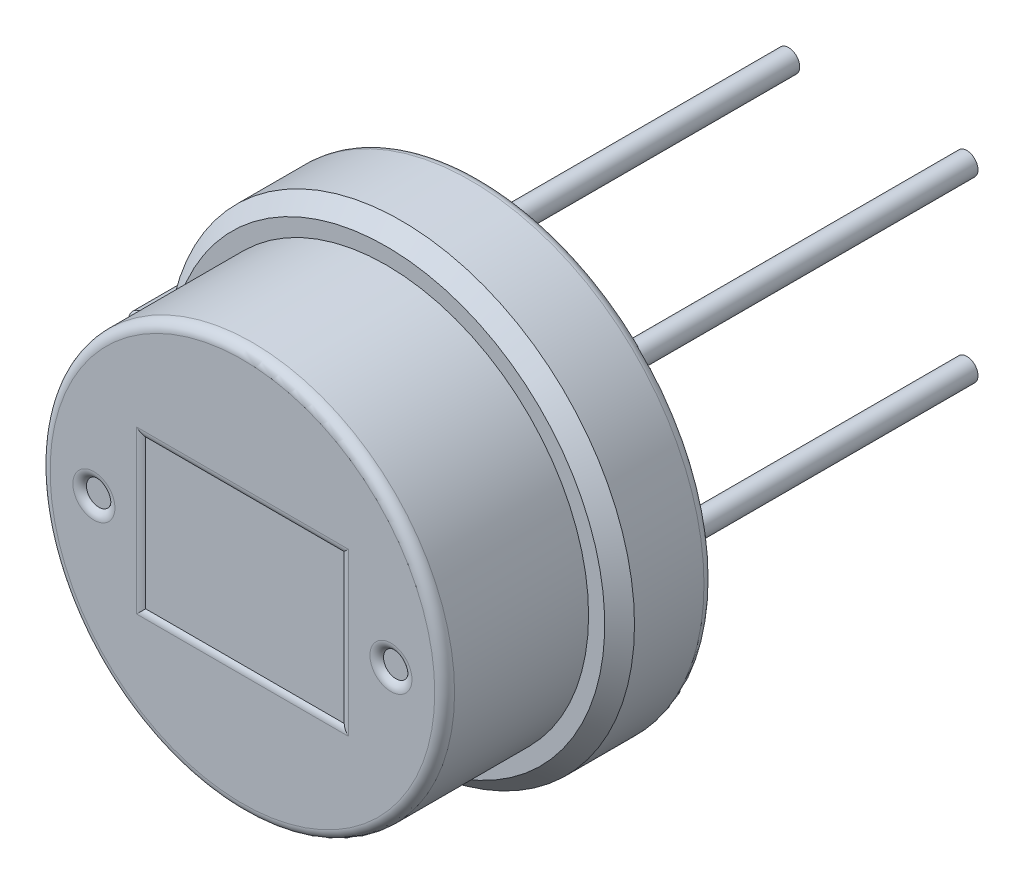
from build123d import *

# Parameters (mm, degrees)
EXTRUDE_417_DEPTH      = 1.9
SKETCH_3_R             = 4.075
EXTRUDE_605_DEPTH      = 2.9
SKETCH_6_W             = 4
SKETCH_6_H             = 3
CUT_EXTRUDE_752_DEPTH  = 0.05
SKETCH_7_R             = 0.25
CUT_EXTRUDE_1002_DEPTH = 0.1
SKETCH_4_R             = 0.225
EXTRUDE_1397_DEPTH     = 8
CHAMFER_1_SIZE         = 0.3
FILLET_1_R             = 0.2


# Some blends are built 0.0001 mm under size
with BuildPart() as part:
    # 草图2 → Extrude 417 (new body)
    with BuildSketch(Plane.XY):
        with BuildLine():
            Line((-5.5, 0.2), (-5.5, -0.2))
            ThreePointArc((-5.5, -0.2), (-5.412132034, -0.412132034), (-5.2, -0.5))
            Line((-5.2, -0.5), (-4.935585072, -0.5))
            ThreePointArc((-4.935585072, -0.5), (-4.741162851, -0.571526807), (-4.639449967, -0.752))
            ThreePointArc((-4.639449967, -0.752), (4.7, 0), (-4.639449967, 0.752))
            ThreePointArc((-4.639449967, 0.752), (-4.741162851, 0.571526807), (-4.935585072, 0.5))
            Line((-4.935585072, 0.5), (-5.2, 0.5))
            ThreePointArc((-5.2, 0.5), (-5.412132034, 0.412132034), (-5.5, 0.2))
        make_face()
    extrude(amount=EXTRUDE_417_DEPTH)

    # 草图3 → Extrude 605 (add)
    with BuildSketch(Plane.XY.offset(1.9)):
        Circle(SKETCH_3_R)
    extrude(amount=EXTRUDE_605_DEPTH)

    # 草图6 → Cut-Extrude 752 (cut)
    with BuildSketch(Plane.XY.offset(4.8)):
        Rectangle(SKETCH_6_W, SKETCH_6_H)
    extrude(amount=-CUT_EXTRUDE_752_DEPTH, mode=Mode.SUBTRACT)

    # 草图7 → Cut-Extrude 1002 (cut)
    with BuildSketch(Plane.XY.offset(4.8)):
        with Locations((-2.992635388, 0)):
            Circle(SKETCH_7_R)
        with Locations(Location((2.992635388, 0, 0), (0, 0, 180))):
            Circle(SKETCH_7_R)
    extrude(amount=-CUT_EXTRUDE_1002_DEPTH, mode=Mode.SUBTRACT)

    # 草图4 → Extrude 1397 (add)
    with BuildSketch(Plane(origin=(0, 0, 0), x_dir=(-1, 0, 0), z_dir=(0, 0, -1))):
        with Locations(Location((-1.796051224, -1.796051224, 0), (0, 0, 180))):
            Circle(SKETCH_4_R)
        with Locations(Location((-1.796051224, 1.796051224, 0), (0, 0, 180))):
            Circle(SKETCH_4_R)
        with Locations(Location((1.796051224, -1.796051224, 0), (0, 0, 180))):
            Circle(SKETCH_4_R)
        with Locations(Location((1.796051224, 1.796051224, 0), (0, 0, 180))):
            Circle(SKETCH_4_R)
    extrude(amount=EXTRUDE_1397_DEPTH)

    # 倒角1
    chamfer_1_edges = [part.edges().sort_by_distance(p)[0] for p in [
        (-4.741162851, 0.571526807, 1.9),
        (-5.067792536, 0.5, 1.9),
        (-5.412132034, 0.412132034, 1.9),
        (-5.5, 0, 1.9),
        (-5.412132034, -0.412132034, 1.9),
        (-5.067792536, -0.5, 1.9),
        (-4.741162851, -0.571526807, 1.9),
        (4.7, 0, 1.9),
    ]]
    chamfer(chamfer_1_edges, length=CHAMFER_1_SIZE - 0.0001)  # a hair under: the kernel refuses the full size

    # 圆角1
    # the kernel refuses this fillet: 0.2 mm, written as the material it takes off along each edge
    with BuildSketch(Plane(origin=(-4.935585072, -0.8, 0), x_dir=(0, 1, 0), z_dir=(-1, 0, 0))) as fillet_1_piece_1:
        with BuildLine():
            CenterArc((0.3 + FILLET_1_R, -FILLET_1_R), FILLET_1_R, 90, 90)
            Line((0.3, -FILLET_1_R), (0.3 - FILLET_1_R * 0.02, -FILLET_1_R))
            Line((0.3 - FILLET_1_R * 0.02, -FILLET_1_R), (0.3 - FILLET_1_R * 0.02, FILLET_1_R * 0.02))
            Line((0.3 - FILLET_1_R * 0.02, FILLET_1_R * 0.02), (0.3 + FILLET_1_R, FILLET_1_R * 0.02))
            Line((0.3 + FILLET_1_R, FILLET_1_R * 0.02), (0.3 + FILLET_1_R, 0))
        make_face()
    revolve(axis=Axis((-4.935585072, -0.8, 0), (0, 0, -1)), revolution_arc=80.793103779, mode=Mode.SUBTRACT)
    with BuildSketch(Plane(origin=(-5.2, -0.5, 0), x_dir=(0, 1, 0), z_dir=(1, 0, 0))) as fillet_1_piece_2:
        with BuildLine():
            CenterArc((FILLET_1_R, FILLET_1_R), FILLET_1_R, 180, 90)
            Line((0, FILLET_1_R), (-FILLET_1_R * 0.02, FILLET_1_R))
            Line((-FILLET_1_R * 0.02, FILLET_1_R), (-FILLET_1_R * 0.02, -FILLET_1_R * 0.02))
            Line((-FILLET_1_R * 0.02, -FILLET_1_R * 0.02), (FILLET_1_R, -FILLET_1_R * 0.02))
            Line((FILLET_1_R, -FILLET_1_R * 0.02), (FILLET_1_R, 0))
        make_face()
    extrude(amount=0.264414928, mode=Mode.SUBTRACT)
    with BuildSketch(Plane(origin=(-5.2, -0.2, 0), x_dir=(-1, 0, 0), z_dir=(0, 1, 0))) as fillet_1_piece_3:
        with BuildLine():
            CenterArc((0.3 - FILLET_1_R, FILLET_1_R), FILLET_1_R, 270, 90)
            Line((0.3, FILLET_1_R), (0.3 + FILLET_1_R * 0.02, FILLET_1_R))
            Line((0.3 + FILLET_1_R * 0.02, FILLET_1_R), (0.3 + FILLET_1_R * 0.02, -FILLET_1_R * 0.02))
            Line((0.3 + FILLET_1_R * 0.02, -FILLET_1_R * 0.02), (0.3 - FILLET_1_R, -FILLET_1_R * 0.02))
            Line((0.3 - FILLET_1_R, -FILLET_1_R * 0.02), (0.3 - FILLET_1_R, 0))
        make_face()
    revolve(axis=Axis((-5.2, -0.2, 0), (0, 0, 1)), revolution_arc=90, mode=Mode.SUBTRACT)
    with BuildSketch(Plane(origin=(-5.5, 0.2, 0), x_dir=(1, 0, 0), z_dir=(0, -1, 0))) as fillet_1_piece_4:
        with BuildLine():
            CenterArc((FILLET_1_R, FILLET_1_R), FILLET_1_R, 180, 90)
            Line((0, FILLET_1_R), (-FILLET_1_R * 0.02, FILLET_1_R))
            Line((-FILLET_1_R * 0.02, FILLET_1_R), (-FILLET_1_R * 0.02, -FILLET_1_R * 0.02))
            Line((-FILLET_1_R * 0.02, -FILLET_1_R * 0.02), (FILLET_1_R, -FILLET_1_R * 0.02))
            Line((FILLET_1_R, -FILLET_1_R * 0.02), (FILLET_1_R, 0))
        make_face()
    extrude(amount=0.4, mode=Mode.SUBTRACT)
    with BuildSketch(Plane(origin=(-5.2, 0.2, 0), x_dir=(0, 1, 0), z_dir=(1, 0, 0))) as fillet_1_piece_5:
        with BuildLine():
            CenterArc((0.3 - FILLET_1_R, FILLET_1_R), FILLET_1_R, 270, 90)
            Line((0.3 - FILLET_1_R, 0), (0.3 - FILLET_1_R, -FILLET_1_R * 0.02))
            Line((0.3 - FILLET_1_R, -FILLET_1_R * 0.02), (0.3 + FILLET_1_R * 0.02, -FILLET_1_R * 0.02))
            Line((0.3 + FILLET_1_R * 0.02, -FILLET_1_R * 0.02), (0.3 + FILLET_1_R * 0.02, FILLET_1_R))
            Line((0.3 + FILLET_1_R * 0.02, FILLET_1_R), (0.3, FILLET_1_R))
        make_face()
    revolve(axis=Axis((-5.2, 0.2, 0), (0, 0, 1)), revolution_arc=90, mode=Mode.SUBTRACT)
    with BuildSketch(Plane(origin=(-4.935585072, 0.5, 0), x_dir=(0, 0, 1), z_dir=(-1, 0, 0))) as fillet_1_piece_6:
        with BuildLine():
            CenterArc((FILLET_1_R, -FILLET_1_R), FILLET_1_R, 90, 90)
            Line((0, -FILLET_1_R), (-FILLET_1_R * 0.02, -FILLET_1_R))
            Line((-FILLET_1_R * 0.02, -FILLET_1_R), (-FILLET_1_R * 0.02, FILLET_1_R * 0.02))
            Line((-FILLET_1_R * 0.02, FILLET_1_R * 0.02), (FILLET_1_R, FILLET_1_R * 0.02))
            Line((FILLET_1_R, FILLET_1_R * 0.02), (FILLET_1_R, 0))
        make_face()
    extrude(amount=0.264414928, mode=Mode.SUBTRACT)
    with BuildSketch(Plane(origin=(-4.935585072, 0.8, 0), x_dir=(0.9871170143402451, -0.16000000000000056, 0), z_dir=(0.16000000000000056, 0.9871170143402451, 0))) as fillet_1_piece_7:
        with BuildLine():
            CenterArc((0.3 + FILLET_1_R, -FILLET_1_R), FILLET_1_R, 90, 90)
            Line((0.3, -FILLET_1_R), (0.3 - FILLET_1_R * 0.02, -FILLET_1_R))
            Line((0.3 - FILLET_1_R * 0.02, -FILLET_1_R), (0.3 - FILLET_1_R * 0.02, FILLET_1_R * 0.02))
            Line((0.3 - FILLET_1_R * 0.02, FILLET_1_R * 0.02), (0.3 + FILLET_1_R, FILLET_1_R * 0.02))
            Line((0.3 + FILLET_1_R, FILLET_1_R * 0.02), (0.3 + FILLET_1_R, 0))
        make_face()
    revolve(axis=Axis((-4.935585072, 0.8, 0), (0, 0, -1)), revolution_arc=80.793103779, mode=Mode.SUBTRACT)
    with BuildSketch(Plane(origin=(0, 0, 4.8), x_dir=(1, 0, 0), z_dir=(0, -1, 0))) as fillet_1_piece_8:
        with BuildLine():
            CenterArc((4.075 - FILLET_1_R, -FILLET_1_R), FILLET_1_R, 0, 90)
            Line((4.075 - FILLET_1_R, 0), (4.075 - FILLET_1_R, FILLET_1_R * 0.02))
            Line((4.075 - FILLET_1_R, FILLET_1_R * 0.02), (4.075 + FILLET_1_R * 0.02, FILLET_1_R * 0.02))
            Line((4.075 + FILLET_1_R * 0.02, FILLET_1_R * 0.02), (4.075 + FILLET_1_R * 0.02, -FILLET_1_R))
            Line((4.075 + FILLET_1_R * 0.02, -FILLET_1_R), (4.075, -FILLET_1_R))
        make_face()
    revolve(axis=Axis((0, 0, 4.8), (0, 0, 1)), mode=Mode.SUBTRACT)
    with BuildSketch(Plane(origin=(0, 0, 0), x_dir=(-0.9871170143402452, -0.16000000000000036, 0), z_dir=(-0.16000000000000036, 0.9871170143402452, 0))) as fillet_1_piece_9:
        with BuildLine():
            CenterArc((4.7 - FILLET_1_R, FILLET_1_R), FILLET_1_R, 270, 90)
            Line((4.7, FILLET_1_R), (4.7 + FILLET_1_R * 0.02, FILLET_1_R))
            Line((4.7 + FILLET_1_R * 0.02, FILLET_1_R), (4.7 + FILLET_1_R * 0.02, -FILLET_1_R * 0.02))
            Line((4.7 + FILLET_1_R * 0.02, -FILLET_1_R * 0.02), (4.7 - FILLET_1_R, -FILLET_1_R * 0.02))
            Line((4.7 - FILLET_1_R, -FILLET_1_R * 0.02), (4.7 - FILLET_1_R, 0))
        make_face()
    revolve(axis=Axis((0, 0, 0), (0, 0, 1)), revolution_arc=341.586207557, mode=Mode.SUBTRACT)
    with BuildSketch(Plane(origin=(2.992635388, 0, 4.8), x_dir=(-1, 0, 0), z_dir=(0, 1, 0))) as fillet_1_piece_10:
        with BuildLine():
            CenterArc((0.423205081, -0.2), FILLET_1_R, 90, 60)
            Line((0.25, -0.1), (0.246535898, -0.098))
            ThreePointArc((0.246535898, -0.098), (0.246, -0.05), (0.246, 0))
            Line((0.246, 0), (0.25, 0.004))
            Line((0.25, 0.004), (0.423205081, 0.004))
            Line((0.423205081, 0.004), (0.423205081, 0))
        make_face()
    revolve(axis=Axis((2.992635388, 0, 4.8), (0, 0, 1)), mode=Mode.SUBTRACT)
    with BuildSketch(Plane(origin=(-2.992635388, 0, 4.8), x_dir=(1, 0, 0), z_dir=(0, -1, 0))) as fillet_1_piece_11:
        with BuildLine():
            CenterArc((0.423205081, -0.2), FILLET_1_R, 90, 60)
            Line((0.25, -0.1), (0.246535898, -0.098))
            ThreePointArc((0.246535898, -0.098), (0.246, -0.05), (0.246, 0))
            Line((0.246, 0), (0.25, 0.004))
            Line((0.25, 0.004), (0.423205081, 0.004))
            Line((0.423205081, 0.004), (0.423205081, 0))
        make_face()
    revolve(axis=Axis((-2.992635388, 0, 4.8), (0, 0, 1)), mode=Mode.SUBTRACT)
    with BuildSketch(Plane(origin=(-2, 1.5, 4.8), x_dir=(0, 1, 0), z_dir=(1, 0, 0)), Plane(origin=(2, -1.5, 4.8), x_dir=(0, -1, 0), z_dir=(-1, 0, 0))) as fillet_1_piece_12:
        with BuildLine():
            CenterArc((0.132287566, -0.2), FILLET_1_R, 90, 41.409622109)
            Line((0, -0.05), (-0.002645751, -0.047))
            ThreePointArc((-0.002645751, -0.047), (-0.004, -0.025), (-0.004, 0))
            Line((-0.004, 0), (0, 0.004))
            Line((0, 0.004), (0.132287566, 0.004))
            Line((0.132287566, 0.004), (0.132287566, 0))
        make_face()
    extrude(amount=4, mode=Mode.SUBTRACT)
    with BuildSketch(Plane(origin=(-2, -1.5, 4.8), x_dir=(-1, 0, 0), z_dir=(0, 1, 0)), Plane(origin=(2, 1.5, 4.8), x_dir=(1, 0, 0), z_dir=(0, -1, 0))) as fillet_1_piece_13:
        with BuildLine():
            CenterArc((0.132287566, -0.2), FILLET_1_R, 90, 41.409622109)
            Line((0, -0.05), (-0.002645751, -0.047))
            ThreePointArc((-0.002645751, -0.047), (-0.004, -0.025), (-0.004, 0))
            Line((-0.004, 0), (0, 0.004))
            Line((0, 0.004), (0.132287566, 0.004))
            Line((0.132287566, 0.004), (0.132287566, 0))
        make_face()
    extrude(amount=3, mode=Mode.SUBTRACT)
    with BuildSketch(Plane(origin=(-2, -1.5, 4.8), x_dir=(-1, 0, 0), z_dir=(0, 1, 0))) as fillet_1_piece_14a_section:
        with BuildLine():
            CenterArc((0.132287566, -0.2), FILLET_1_R, 90, 41.409622109)
            Line((0, -0.05), (-0.002645751, -0.047))
            ThreePointArc((-0.002645751, -0.047), (-0.004, -0.025), (-0.004, 0))
            Line((-0.004, 0), (0, 0.004))
            Line((0, 0.004), (0.132287566, 0.004))
            Line((0.132287566, 0.004), (0.132287566, 0))
        make_face()
    fillet_1_piece_14a = extrude(amount=3.330718914, mode=Mode.PRIVATE)
    fillet_1_piece_14a = split(fillet_1_piece_14a, bisect_by=Plane(origin=(-2.036281513, 1.5, 4.788045002), z_dir=(0, 1, 0)), keep=Keep.TOP, mode=Mode.PRIVATE)
    with BuildSketch(Plane(origin=(-2.330718914, 1.5, 4.8), x_dir=(0, 1, 0), z_dir=(1, 0, 0))) as fillet_1_piece_14b_section:
        with BuildLine():
            CenterArc((0.132287566, -0.2), FILLET_1_R, 90, 41.409622109)
            Line((0, -0.05), (-0.002645751, -0.047))
            ThreePointArc((-0.002645751, -0.047), (-0.004, -0.025), (-0.004, 0))
            Line((-0.004, 0), (0, 0.004))
            Line((0, 0.004), (0.132287566, 0.004))
            Line((0.132287566, 0.004), (0.132287566, 0))
        make_face()
    fillet_1_piece_14b = extrude(amount=4.330718914, mode=Mode.PRIVATE)
    fillet_1_piece_14b = split(fillet_1_piece_14b, bisect_by=Plane(origin=(-2, 1.536281513, 4.788045002), z_dir=(-1, 0, 0)), keep=Keep.TOP, mode=Mode.PRIVATE)
    fillet_1_piece_14 = fillet_1_piece_14a & fillet_1_piece_14b
    add(fillet_1_piece_14, mode=Mode.SUBTRACT)
    with BuildSketch(Plane(origin=(-2, 1.5, 4.8), x_dir=(0, 1, 0), z_dir=(1, 0, 0))) as fillet_1_piece_15a_section:
        with BuildLine():
            CenterArc((0.132287566, -0.2), FILLET_1_R, 90, 41.409622109)
            Line((0, -0.05), (-0.002645751, -0.047))
            ThreePointArc((-0.002645751, -0.047), (-0.004, -0.025), (-0.004, 0))
            Line((-0.004, 0), (0, 0.004))
            Line((0, 0.004), (0.132287566, 0.004))
            Line((0.132287566, 0.004), (0.132287566, 0))
        make_face()
    fillet_1_piece_15a = extrude(amount=4.330718914, mode=Mode.PRIVATE)
    fillet_1_piece_15a = split(fillet_1_piece_15a, bisect_by=Plane(origin=(2, 1.536281513, 4.788045002), z_dir=(1, 0, 0)), keep=Keep.TOP, mode=Mode.PRIVATE)
    with BuildSketch(Plane(origin=(2, 1.830718914, 4.8), x_dir=(1, 0, 0), z_dir=(0, -1, 0))) as fillet_1_piece_15b_section:
        with BuildLine():
            CenterArc((0.132287566, -0.2), FILLET_1_R, 90, 41.409622109)
            Line((0, -0.05), (-0.002645751, -0.047))
            ThreePointArc((-0.002645751, -0.047), (-0.004, -0.025), (-0.004, 0))
            Line((-0.004, 0), (0, 0.004))
            Line((0, 0.004), (0.132287566, 0.004))
            Line((0.132287566, 0.004), (0.132287566, 0))
        make_face()
    fillet_1_piece_15b = extrude(amount=3.330718914, mode=Mode.PRIVATE)
    fillet_1_piece_15b = split(fillet_1_piece_15b, bisect_by=Plane(origin=(2.036281513, 1.5, 4.788045002), z_dir=(0, 1, 0)), keep=Keep.TOP, mode=Mode.PRIVATE)
    fillet_1_piece_15 = fillet_1_piece_15a & fillet_1_piece_15b
    add(fillet_1_piece_15, mode=Mode.SUBTRACT)
    with BuildSketch(Plane(origin=(-2, -1.830718914, 4.8), x_dir=(-1, 0, 0), z_dir=(0, 1, 0))) as fillet_1_piece_16a_section:
        with BuildLine():
            CenterArc((0.132287566, -0.2), FILLET_1_R, 90, 41.409622109)
            Line((0, -0.05), (-0.002645751, -0.047))
            ThreePointArc((-0.002645751, -0.047), (-0.004, -0.025), (-0.004, 0))
            Line((-0.004, 0), (0, 0.004))
            Line((0, 0.004), (0.132287566, 0.004))
            Line((0.132287566, 0.004), (0.132287566, 0))
        make_face()
    fillet_1_piece_16a = extrude(amount=3.330718914, mode=Mode.PRIVATE)
    fillet_1_piece_16a = split(fillet_1_piece_16a, bisect_by=Plane(origin=(-2.036281513, -1.5, 4.788045002), z_dir=(0, -1, 0)), keep=Keep.TOP, mode=Mode.PRIVATE)
    with BuildSketch(Plane(origin=(2, -1.5, 4.8), x_dir=(0, -1, 0), z_dir=(-1, 0, 0))) as fillet_1_piece_16b_section:
        with BuildLine():
            CenterArc((0.132287566, -0.2), FILLET_1_R, 90, 41.409622109)
            Line((0, -0.05), (-0.002645751, -0.047))
            ThreePointArc((-0.002645751, -0.047), (-0.004, -0.025), (-0.004, 0))
            Line((-0.004, 0), (0, 0.004))
            Line((0, 0.004), (0.132287566, 0.004))
            Line((0.132287566, 0.004), (0.132287566, 0))
        make_face()
    fillet_1_piece_16b = extrude(amount=4.330718914, mode=Mode.PRIVATE)
    fillet_1_piece_16b = split(fillet_1_piece_16b, bisect_by=Plane(origin=(-2, -1.536281513, 4.788045002), z_dir=(-1, 0, 0)), keep=Keep.TOP, mode=Mode.PRIVATE)
    fillet_1_piece_16 = fillet_1_piece_16a & fillet_1_piece_16b
    add(fillet_1_piece_16, mode=Mode.SUBTRACT)
    with BuildSketch(Plane(origin=(2.330718914, -1.5, 4.8), x_dir=(0, -1, 0), z_dir=(-1, 0, 0))) as fillet_1_piece_17a_section:
        with BuildLine():
            CenterArc((0.132287566, -0.2), FILLET_1_R, 90, 41.409622109)
            Line((0, -0.05), (-0.002645751, -0.047))
            ThreePointArc((-0.002645751, -0.047), (-0.004, -0.025), (-0.004, 0))
            Line((-0.004, 0), (0, 0.004))
            Line((0, 0.004), (0.132287566, 0.004))
            Line((0.132287566, 0.004), (0.132287566, 0))
        make_face()
    fillet_1_piece_17a = extrude(amount=4.330718914, mode=Mode.PRIVATE)
    fillet_1_piece_17a = split(fillet_1_piece_17a, bisect_by=Plane(origin=(2, -1.536281513, 4.788045002), z_dir=(1, 0, 0)), keep=Keep.TOP, mode=Mode.PRIVATE)
    with BuildSketch(Plane(origin=(2, 1.5, 4.8), x_dir=(1, 0, 0), z_dir=(0, -1, 0))) as fillet_1_piece_17b_section:
        with BuildLine():
            CenterArc((0.132287566, -0.2), FILLET_1_R, 90, 41.409622109)
            Line((0, -0.05), (-0.002645751, -0.047))
            ThreePointArc((-0.002645751, -0.047), (-0.004, -0.025), (-0.004, 0))
            Line((-0.004, 0), (0, 0.004))
            Line((0, 0.004), (0.132287566, 0.004))
            Line((0.132287566, 0.004), (0.132287566, 0))
        make_face()
    fillet_1_piece_17b = extrude(amount=3.330718914, mode=Mode.PRIVATE)
    fillet_1_piece_17b = split(fillet_1_piece_17b, bisect_by=Plane(origin=(2.036281513, -1.5, 4.788045002), z_dir=(0, -1, 0)), keep=Keep.TOP, mode=Mode.PRIVATE)
    fillet_1_piece_17 = fillet_1_piece_17a & fillet_1_piece_17b
    add(fillet_1_piece_17, mode=Mode.SUBTRACT)


solid = part.part
